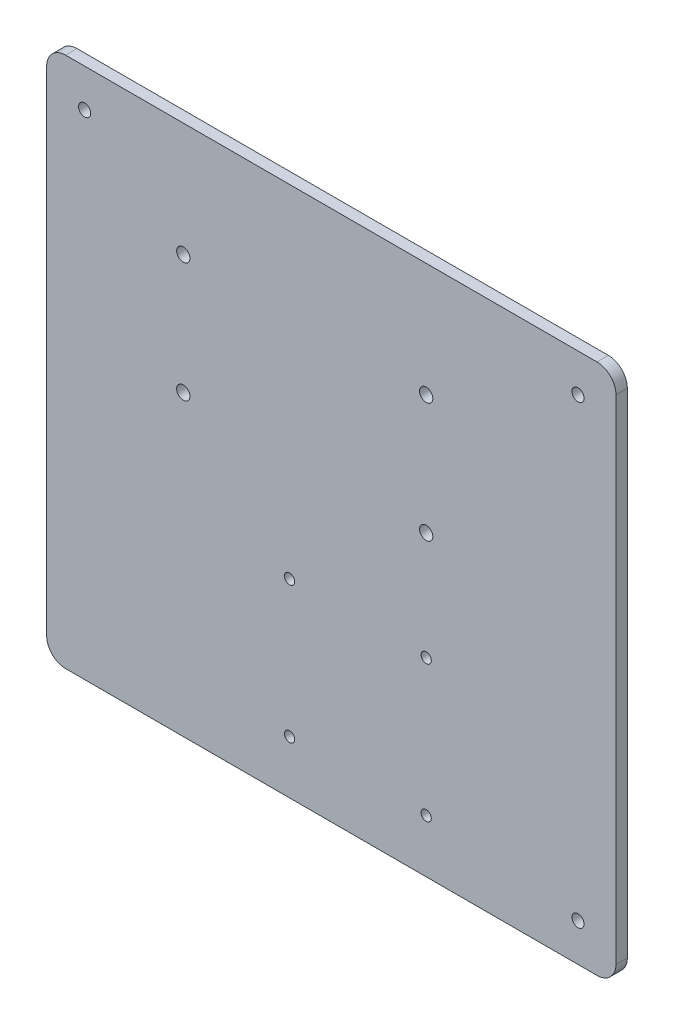
from build123d import *

# Parameters (mm, degrees)
SKETCH_1_W          = 150
SKETCH_1_H          = 140
EXTRUDE_1_DEPTH     = 3
SKETCH_3_R          = 1.75
CUT_EXTRUDE_1_DEPTH = 10
SKETCH_4_R          = 1.35
CUT_EXTRUDE_2_DEPTH = 10
SKETCH_5_R          = 1.6
CUT_EXTRUDE_3_DEPTH = 10
FILLET_1_R          = 5


with BuildPart() as part:
    # 草图1 → 凸台-拉伸1 (new body)
    with BuildSketch(Plane.XY):
        Rectangle(SKETCH_1_W, SKETCH_1_H)
    extrude(amount=EXTRUDE_1_DEPTH)

    # 草图3 → 切除-拉伸1 (cut)
    with BuildSketch(Plane.XY.offset(3)):
        with Locations((25, 40)):
            Circle(SKETCH_3_R)
        with Locations((-39, 40)):
            Circle(SKETCH_3_R)
        with Locations((25, 8.5)):
            Circle(SKETCH_3_R)
        with Locations((-39, 8.5)):
            Circle(SKETCH_3_R)
    extrude(amount=-CUT_EXTRUDE_1_DEPTH, mode=Mode.SUBTRACT)

    # 草图4 → 切除-拉伸2 (cut)
    with BuildSketch(Plane.XY.offset(3)):
        with Locations((25, -20)):
            Circle(SKETCH_4_R)
        with Locations((-11, -20)):
            Circle(SKETCH_4_R)
        with Locations((-11, -56)):
            Circle(SKETCH_4_R)
        with Locations((25, -56)):
            Circle(SKETCH_4_R)
    extrude(amount=-CUT_EXTRUDE_2_DEPTH, mode=Mode.SUBTRACT)

    # 草图5 → 切除-拉伸3 (cut)
    with BuildSketch(Plane.XY.offset(3)):
        with Locations((65, 60)):
            Circle(SKETCH_5_R)
        with Locations((-65, 60)):
            Circle(SKETCH_5_R)
        with Locations((65, -60)):
            Circle(SKETCH_5_R)
    extrude(amount=-CUT_EXTRUDE_3_DEPTH, mode=Mode.SUBTRACT)

    # 圆角1
    fillet_1_edges = [part.edges().sort_by_distance(p)[0] for p in [
        (-75, -70, 1.5),
        (75, -70, 1.5),
        (75, 70, 1.5),
        (-75, 70, 1.5),
    ]]
    fillet(fillet_1_edges, radius=FILLET_1_R)


solid = part.part
